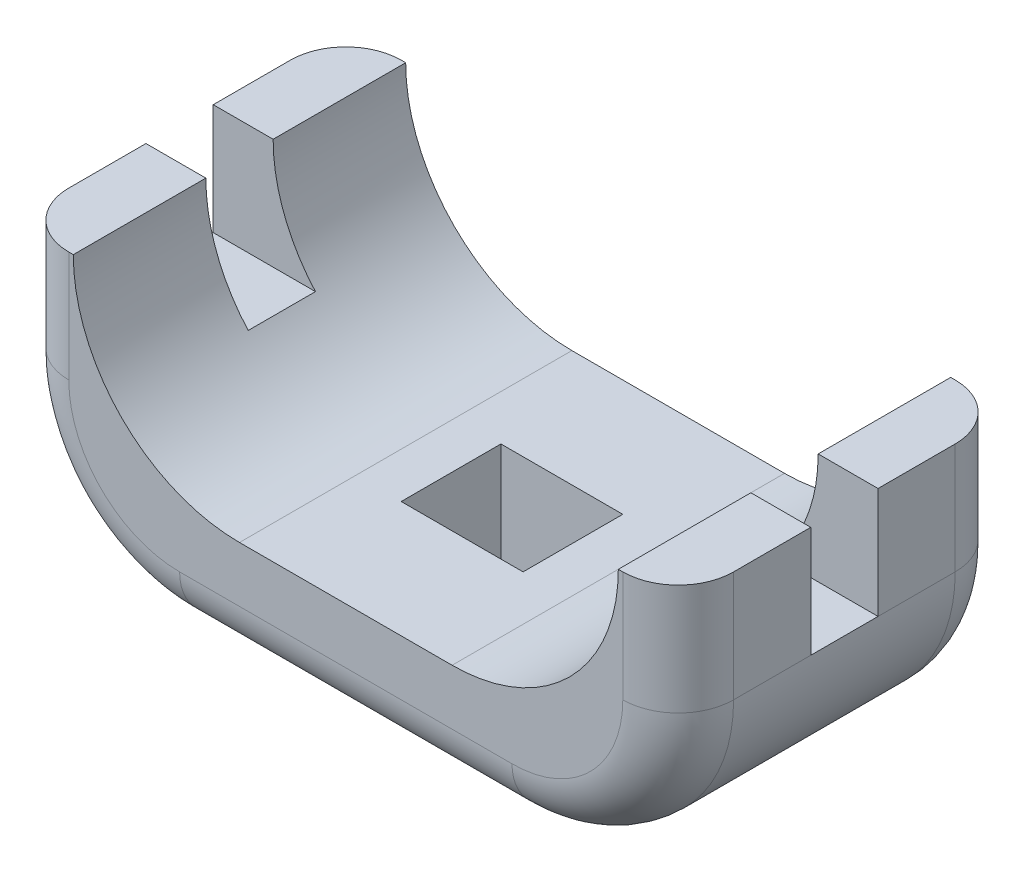
from build123d import *

# Parameters (mm, degrees)
SKETCH_1_W          = 12
SKETCH_1_H          = 6
EXTRUDE_1_DEPTH     = 5
SKETCH_2_W          = 2.2
SKETCH_2_H          = 1.8
CUT_EXTRUDE_1_DEPTH = 5
FILLET_1_R          = 3
SKETCH_3_W          = 9.838074984
SKETCH_3_H          = 6
CUT_EXTRUDE_2_DEPTH = 3
FILLET_2_R          = 3
FILLET_3_R          = 1
FILLET_4_R          = 1
SKETCH_4_W          = 12
SKETCH_4_H          = 1.214577158
CUT_EXTRUDE_3_DEPTH = 2


with BuildPart() as part:
    # Эскиз1 → Бобышка-Вытянуть1 (new body)
    with BuildSketch(Plane(origin=(0, 0, 0), x_dir=(1, 0, 0), z_dir=(0, 1, 0))):
        Rectangle(SKETCH_1_W, SKETCH_1_H)
    extrude(amount=EXTRUDE_1_DEPTH)

    # Эскиз2 → Вырез-Вытянуть1 (cut)
    with BuildSketch(Plane.XZ):
        Rectangle(SKETCH_2_W, SKETCH_2_H)
    extrude(amount=-CUT_EXTRUDE_1_DEPTH, mode=Mode.SUBTRACT)

    # Скругление1
    fillet_1_edges = [part.edges().sort_by_distance(p)[0] for p in [
        (6, 0, 0),
        (-6, 0, 0),
    ]]
    fillet(fillet_1_edges, radius=FILLET_1_R)

    # Эскиз3 → Вырез-Вытянуть2 (cut)
    with BuildSketch(Plane(origin=(0, 5, 0), x_dir=(1, 0, 0), z_dir=(0, 1, 0))):
        Rectangle(SKETCH_3_W, SKETCH_3_H)
    extrude(amount=-CUT_EXTRUDE_2_DEPTH, mode=Mode.SUBTRACT)

    # Скругление2
    fillet_2_edges = [part.edges().sort_by_distance(p)[0] for p in [
        (4.919037492, 2, 0),
        (-4.919037492, 2, 0),
    ]]
    fillet(fillet_2_edges, radius=FILLET_2_R - 0.0001)  # a hair under: the kernel refuses the full size

    # Скругление3
    fillet_3_edges = [part.edges().sort_by_distance(p)[0] for p in [
        (0, 0, -3),
        (-5.121320344, 0.878679656, -3),
        (5.121320344, 0.878679656, -3),
        (-6, 4, -3),
        (6, 4, -3),
    ]]
    fillet(fillet_3_edges, radius=FILLET_3_R)

    # Скругление4
    fillet_4_edges = [part.edges().sort_by_distance(p)[0] for p in [
        (0, 0, 3),
        (-5.121320344, 0.878679656, 3),
        (5.121320344, 0.878679656, 3),
        (6, 4, 3),
        (-6, 4, 3),
    ]]
    fillet(fillet_4_edges, radius=FILLET_4_R)

    # Эскиз4 → Вырез-Вытянуть3 (cut)
    with BuildSketch(Plane(origin=(0, 5, 0), x_dir=(1, 0, 0), z_dir=(0, 1, 0))):
        Rectangle(SKETCH_4_W, SKETCH_4_H)
    extrude(amount=-CUT_EXTRUDE_3_DEPTH, mode=Mode.SUBTRACT)


solid = part.part
